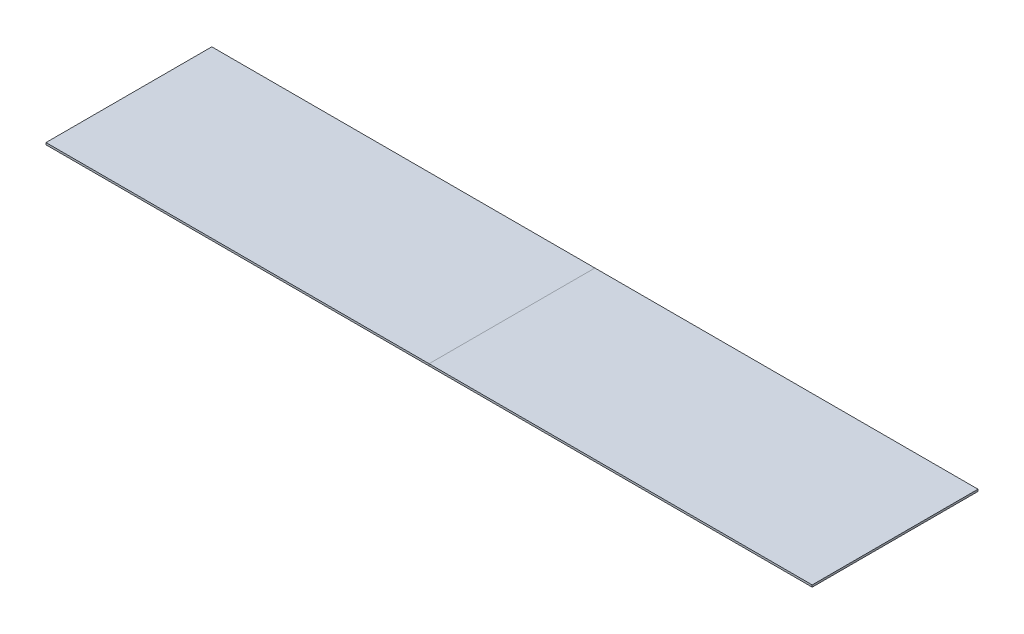
from build123d import *

# Parameters (mm, degrees)
SKETCH1_W           = 2310.8
SKETCH1_H           = 500
BOSS_EXTRUDE1_DEPTH = 6


# Read off the part's stored shape, not the designer's step: Split2
with BuildPart() as part:
    # Sketch1 → Boss-Extrude1 (new body)
    with BuildSketch(Plane(origin=(0, 0, 0), x_dir=(1, 0, 0), z_dir=(0, 1, 0))):
        with Locations((1155.4, 250)):
            Rectangle(SKETCH1_W, SKETCH1_H)
    extrude(amount=BOSS_EXTRUDE1_DEPTH)


with BuildPart() as body_2:
    # Split2: the piece on the far side of the plane
    add(part.part)
    split(bisect_by=Plane.YZ.offset(1155.4), keep=Keep.BOTTOM)


with BuildPart() as part_1:
    add(part.part)

    # Split2
    split(bisect_by=Plane.YZ.offset(1155.4), keep=Keep.TOP)


solid = Compound([body_2.part, part_1.part])
